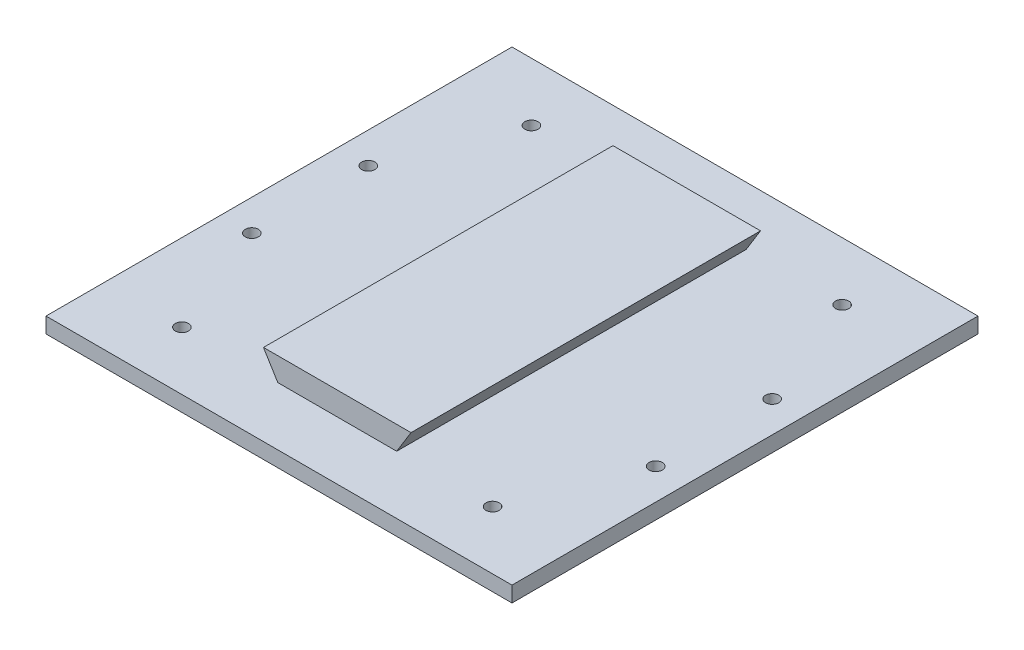
from build123d import *

# Parameters (mm, degrees)
SKETCH1_W             = 120
SKETCH1_H             = 120
RAIL_PLATE_DEPTH      = 4
DOVETAIL_RAIL_DEPTH   = 45
BOLT_HOLES_DEPTH      = 86.440037453
BOLT_HOLES_DEPTH_BACK = 86.440037453
SKETCH3_R             = 1.7


with BuildPart() as part:
    # Sketch1 → Rail Plate (new body)
    with BuildSketch(Plane(origin=(0, 0, 0), x_dir=(1, 0, 0), z_dir=(0, 1, 0))):
        Rectangle(SKETCH1_W, SKETCH1_H)
    extrude(amount=RAIL_PLATE_DEPTH)

    # Sketch2 → Dovetail Rail (add, symmetric)
    with BuildSketch(Plane.XY):
        Polygon((-15, 3.5), (15, 3.5), (19, 10), (-19, 10), align=None)
    extrude(amount=DOVETAIL_RAIL_DEPTH, both=True)

    # Sketch3 → Bolt Holes (cut, two sides: drawn at the far end of the back side and taken through both)
    with BuildSketch(Plane(origin=(0, 0, 0), x_dir=(1, 0, 0), z_dir=(0, 1, 0)).offset(-BOLT_HOLES_DEPTH_BACK)):
        with Locations((-40, -45)):
            Circle(SKETCH3_R)
        with Locations((-40, 45)):
            Circle(SKETCH3_R)
        with Locations((40, -45)):
            Circle(SKETCH3_R)
        with Locations((40, 45)):
            Circle(SKETCH3_R)
        with Locations((-52, -15)):
            Circle(SKETCH3_R)
        with Locations((-52, 15)):
            Circle(SKETCH3_R)
        with Locations((52, -15)):
            Circle(SKETCH3_R)
        with Locations((52, 15)):
            Circle(SKETCH3_R)
    extrude(amount=BOLT_HOLES_DEPTH + BOLT_HOLES_DEPTH_BACK, mode=Mode.SUBTRACT)


solid = part.part
